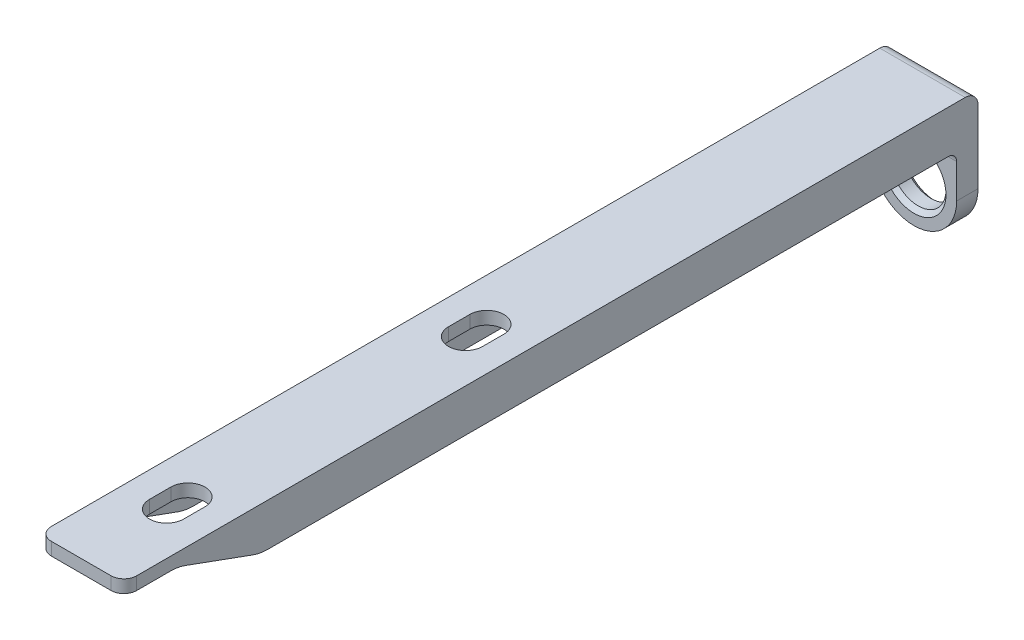
from build123d import *

# Parameters (mm, degrees)
BOSS_EXTRUDE1_DEPTH = 20
CUT_EXTRUDE1_DEPTH  = 20
LPATTERN1_COUNT     = 2
LPATTERN1_PITCH     = 70
SKETCH3_R           = 6.5
CUT_EXTRUDE2_DEPTH  = 20
FILLET1_R           = 3
FILLET2_R           = 10
CHAMFER1_SIZE       = 1
FILLET3_R           = 3
SKETCH4_W           = 2.5
SKETCH4_H           = 193.282741961
BOSS_EXTRUDE2_DEPTH = 7
LPATTERN2_COUNT     = 2
LPATTERN2_PITCH     = 17.5
CHAMFER2_SIZE       = 27.474774195
CHAMFER2_SIZE_2     = 10
FILLET4_R           = 10
FILLET5_R           = 2


# Some blends are built 0.0001 mm under size
with BuildPart() as part:
    # Sketch1 → Boss-Extrude1 (new body)
    with BuildSketch(Plane(origin=(0, 0, 0), x_dir=(0, 0, -1), z_dir=(1, 0, 0))):
        Polygon((-159.787234043, 21.769316909), (40.212765957, 21.769316909), (40.212765957, -8.230683091), (35.212765957, -8.230683091), (35.212765957, 18.769316909), (-159.787234043, 18.769316909), align=None)
    extrude(amount=BOSS_EXTRUDE1_DEPTH)

    # Sketch2 → Cut-Extrude1 (cut)
    with BuildSketch(Plane.XZ.offset(-18.769316909)):
        with BuildLine():
            Line((14, 139.787234043), (14, 134.787234043))
            ThreePointArc((14, 134.787234043), (10, 130.787234043), (6, 134.787234043))
            Line((6, 134.787234043), (6, 139.787234043))
            ThreePointArc((6, 139.787234043), (10, 143.787234043), (14, 139.787234043))
        make_face()
    cut_extrude1 = extrude(amount=-CUT_EXTRUDE1_DEPTH, mode=Mode.SUBTRACT)

    # LPattern1: Cut-Extrude1 ×2
    with Locations(*[(0, 0, -i * LPATTERN1_PITCH) for i in range(1, LPATTERN1_COUNT)]):
        add(cut_extrude1, mode=Mode.SUBTRACT)

    # Sketch3 → Cut-Extrude2 (cut)
    with BuildSketch(Plane.XY.offset(-35.212765957)):
        with Locations((10, 1.769316909)):
            Circle(SKETCH3_R)
    extrude(amount=-CUT_EXTRUDE2_DEPTH, mode=Mode.SUBTRACT)

    # Fillet1
    fillet1_edges = [part.edges().sort_by_distance(p)[0] for p in [
        (10, 21.769316909, -40.212765957),
        (10, 18.769316909, -35.212765957),
    ]]
    fillet(fillet1_edges, radius=FILLET1_R)

    # Fillet2
    fillet2_edges = [part.edges().sort_by_distance(p)[0] for p in [
        (0, -8.230683091, -37.712765957),
        (20, -8.230683091, -37.712765957),
    ]]
    fillet(fillet2_edges, radius=FILLET2_R - 0.0001)  # a hair under: the kernel refuses the full size

    # Chamfer1
    chamfer1_edges = [part.edges().sort_by_distance(p)[0] for p in [
        (3.5, 1.769316909, -40.212765957),
        (3.5, 1.769316909, -35.212765957),
    ]]
    chamfer(chamfer1_edges, length=CHAMFER1_SIZE)

    # Fillet3
    fillet3_edges = [part.edges().sort_by_distance(p)[0] for p in [
        (20, 20.269316909, 159.787234043),
        (0, 20.269316909, 159.787234043),
    ]]
    fillet(fillet3_edges, radius=FILLET3_R)

    # Sketch4 → Boss-Extrude2 (add)
    with BuildSketch(Plane.XZ.offset(-18.769316909)):
        with Locations((1.25, 58.701442972)):
            Rectangle(SKETCH4_W, SKETCH4_H)
    boss_extrude2 = extrude(amount=BOSS_EXTRUDE2_DEPTH)

    # LPattern2: Boss-Extrude2 ×2
    with Locations(*[(i * LPATTERN2_PITCH, 0, 0) for i in range(1, LPATTERN2_COUNT)]):
        add(boss_extrude2)

    # Chamfer2
    # the kernel refuses this chamfer: 27.474774195, 10 mm, written as the material it takes off along each edge
    with BuildSketch(Plane(origin=(73.774914494, 11.769316909, 155.342813952), x_dir=(0, -0.013184058198645638, -0.9999130865277315), z_dir=(-1, 0, 0))) as chamfer2_piece_1_section:
        Polygon((CHAMFER2_SIZE * 0.999913086511, -CHAMFER2_SIZE * 0.0131840581984), (-CHAMFER2_SIZE_2 * 0.0131840581986, -CHAMFER2_SIZE_2 * 0.999913086528), (0, 0), align=None)
    chamfer2_piece_1 = extrude(amount=145.049828987, mode=Mode.PRIVATE)
    chamfer2_piece_1 = split(chamfer2_piece_1, bisect_by=Plane(origin=(1.25, 18.769316909, 145.126312786), z_dir=(0, -1, 0)), keep=Keep.TOP, mode=Mode.PRIVATE)
    add(chamfer2_piece_1, mode=Mode.SUBTRACT)
    with BuildSketch(Plane(origin=(91.274914494, 11.769316909, 155.342813952), x_dir=(0, -0.013184058198645638, -0.9999130865277315), z_dir=(-1, 0, 0))) as chamfer2_piece_2_section:
        Polygon((CHAMFER2_SIZE * 0.999913086511, -CHAMFER2_SIZE * 0.0131840581984), (-CHAMFER2_SIZE_2 * 0.0131840581986, -CHAMFER2_SIZE_2 * 0.999913086528), (0, 0), align=None)
    chamfer2_piece_2 = extrude(amount=145.049828987, mode=Mode.PRIVATE)
    chamfer2_piece_2 = split(chamfer2_piece_2, bisect_by=Plane(origin=(18.75, 18.769316909, 145.126312786), z_dir=(0, -1, 0)), keep=Keep.TOP, mode=Mode.PRIVATE)
    add(chamfer2_piece_2, mode=Mode.SUBTRACT)

    # Fillet4
    fillet4_edges = [part.edges().sort_by_distance(p)[0] for p in [
        (1.25, 11.769316909, 127.868039758),
        (18.75, 11.769316909, 127.868039758),
        (1.25, 18.769316909, 147.100381694),
        (18.75, 18.769316909, 147.100381694),
    ]]
    fillet(fillet4_edges, radius=FILLET4_R)

    # Fillet5
    fillet5_edges = [part.edges().sort_by_distance(p)[0] for p in [
        (1.25, 11.769316909, -35.212765957),
        (18.75, 11.769316909, -35.212765957),
    ]]
    fillet(fillet5_edges, radius=FILLET5_R)


solid = part.part
